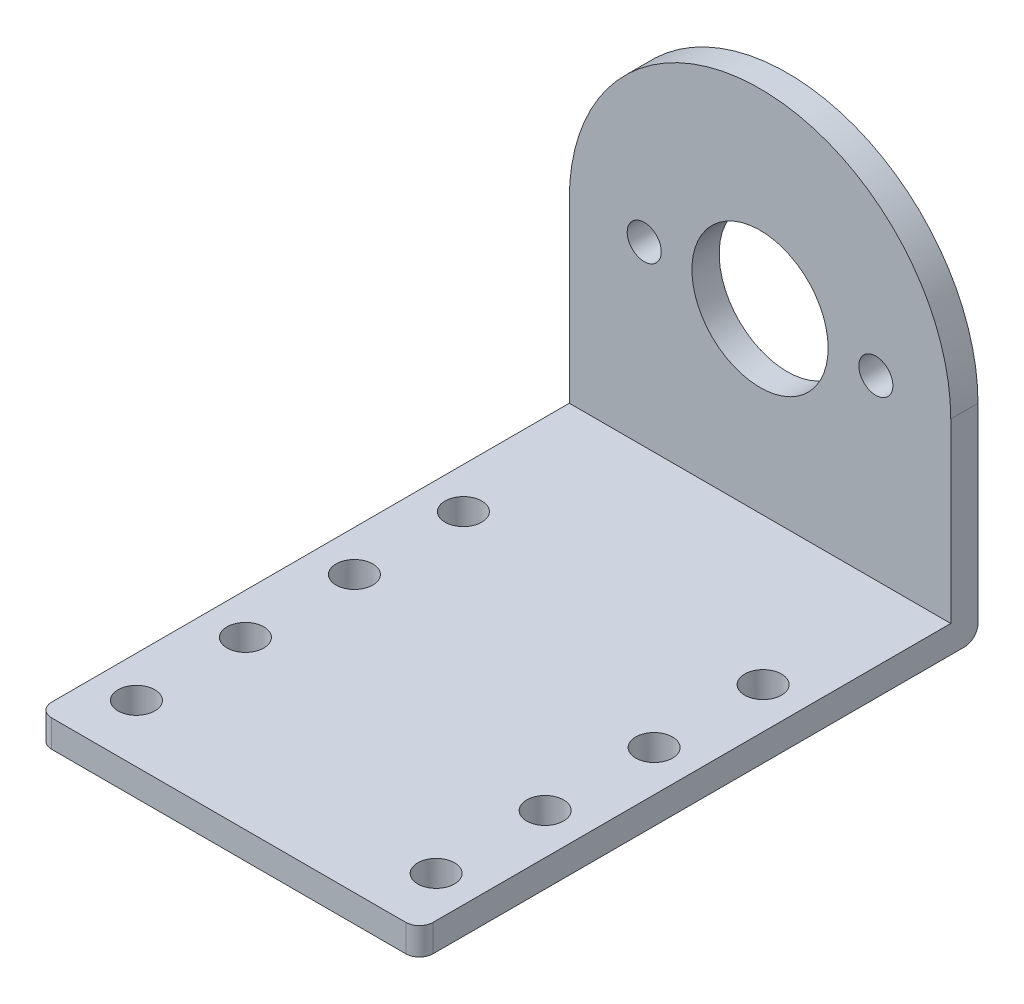
from build123d import *

# Parameters (mm, degrees)
SKETCH1_R           = 5
SKETCH1_R_2         = 1.25
BOSS_EXTRUDE1_DEPTH = 2
SKETCH2_W           = 28
SKETCH2_H           = 2
BOSS_EXTRUDE2_DEPTH = 39
FILLET1_R           = 1
SKETCH3_R           = 1.35
CUT_EXTRUDE1_DEPTH  = 17


with BuildPart() as part:
    # Sketch1 → Boss-Extrude1 (new body)
    with BuildSketch(Plane.XY):
        with BuildLine():
            Line((-14, 0), (-14, -15))
            Line((-14, -15), (14, -15))
            Line((14, -15), (14, 0))
            ThreePointArc((14, 0), (0, 14), (-14, 0))
        make_face()
        Circle(SKETCH1_R, mode=Mode.SUBTRACT)
        with Locations((-8.5, 0)):
            Circle(SKETCH1_R_2, mode=Mode.SUBTRACT)
        with Locations((8.5, 0)):
            Circle(SKETCH1_R_2, mode=Mode.SUBTRACT)
    extrude(amount=BOSS_EXTRUDE1_DEPTH)

    # Sketch2 → Boss-Extrude2 (add)
    with BuildSketch(Plane.XY.offset(2)):
        with Locations((0, -14)):
            Rectangle(SKETCH2_W, SKETCH2_H)
    extrude(amount=BOSS_EXTRUDE2_DEPTH)

    # Fillet1
    fillet1_edges = [part.edges().sort_by_distance(p)[0] for p in [
        (14, -14, 41),
        (-14, -14, 41),
        (0, -15, 0),
    ]]
    fillet(fillet1_edges, radius=FILLET1_R)

    # Sketch3 → Cut-Extrude1 (cut)
    with BuildSketch(Plane(origin=(0, -13, 0), x_dir=(1, 0, 0), z_dir=(0, 1, 0))):
        with Locations((-11, -12.7736266)):
            Circle(SKETCH3_R)
        with Locations((-11, -36.7736266)):
            Circle(SKETCH3_R)
        with Locations((11, -36.7736266)):
            Circle(SKETCH3_R)
        with Locations((11, -12.7736266)):
            Circle(SKETCH3_R)
        with Locations((-11, -20.7736266)):
            Circle(SKETCH3_R)
        with Locations((-11, -28.7736266)):
            Circle(SKETCH3_R)
        with Locations((11, -28.7736266)):
            Circle(SKETCH3_R)
        with Locations((11, -20.7736266)):
            Circle(SKETCH3_R)
    extrude(amount=-CUT_EXTRUDE1_DEPTH, mode=Mode.SUBTRACT)


solid = part.part
